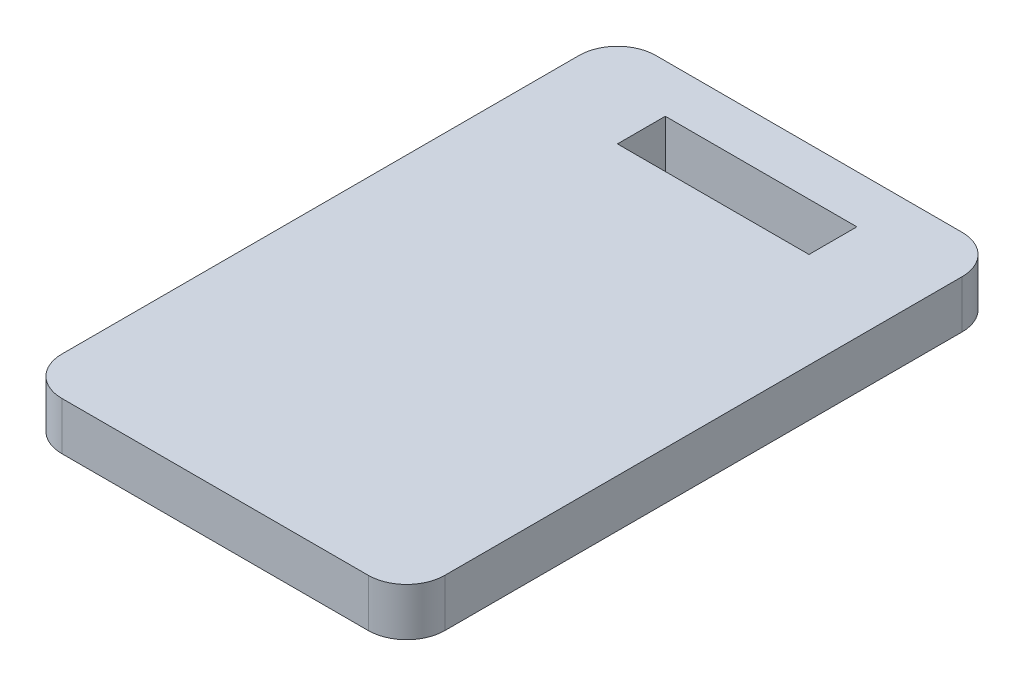
from build123d import *

# Parameters (mm, degrees)
SKETCH1_W           = 25.4
SKETCH1_H           = 39.38
BOSS_EXTRUDE1_DEPTH = 3.175
SKETCH2_W           = 12.7
SKETCH2_H           = 3.175
CUT_EXTRUDE1_DEPTH  = 47.968340667
FILLET1_R           = 2.54


with BuildPart() as part:
    # Sketch1 → Boss-Extrude1 (new body)
    with BuildSketch(Plane(origin=(0, 0, 0), x_dir=(1, 0, 0), z_dir=(0, 1, 0))):
        with Locations((12.7, 19.69)):
            Rectangle(SKETCH1_W, SKETCH1_H)
    extrude(amount=BOSS_EXTRUDE1_DEPTH)

    # Sketch2 → Cut-Extrude1 (cut, through all)
    with BuildSketch(Plane(origin=(0, 3.175, 0), x_dir=(1, 0, 0), z_dir=(0, 1, 0))):
        with Locations((12.7, 34.6175)):
            Rectangle(SKETCH2_W, SKETCH2_H)
    extrude(amount=-CUT_EXTRUDE1_DEPTH, mode=Mode.SUBTRACT)

    # Fillet1
    fillet1_edges = [part.edges().sort_by_distance(p)[0] for p in [
        (0, 1.5875, -39.38),
        (25.4, 1.5875, -39.38),
        (25.4, 1.5875, 0),
        (0, 1.5875, 0),
    ]]
    fillet(fillet1_edges, radius=FILLET1_R)


solid = part.part
